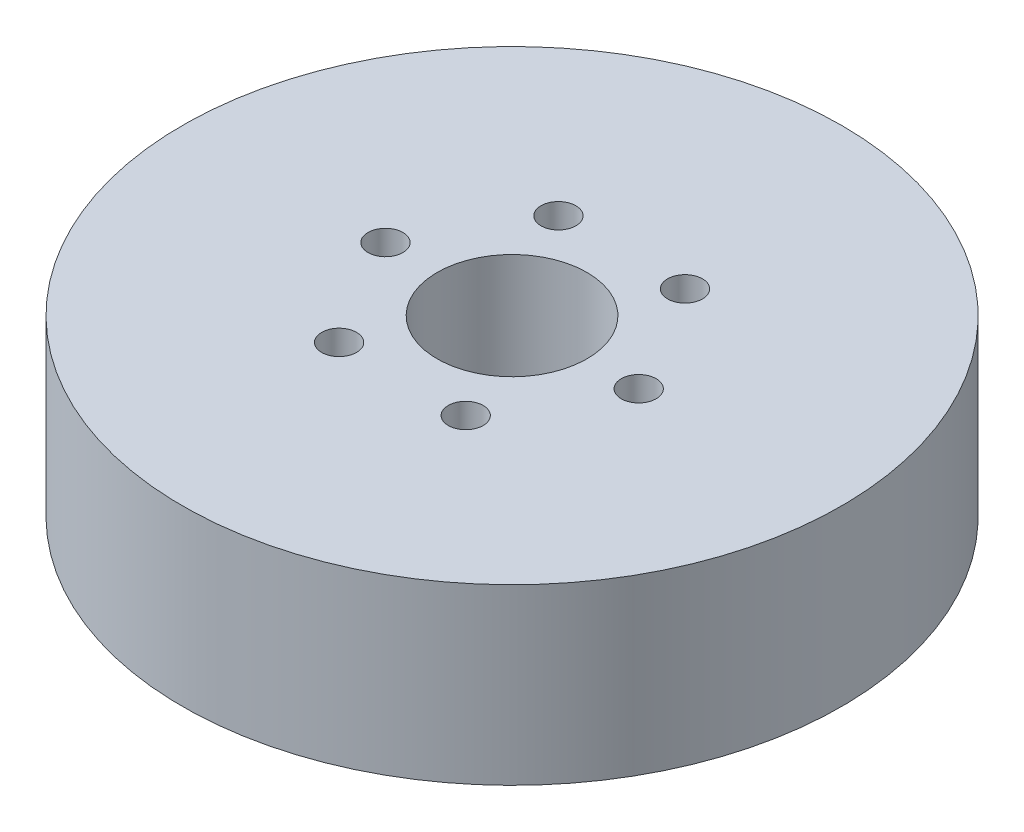
from build123d import *

# Parameters (mm, degrees)
SKETCH1_R           = 55
BOSS_EXTRUDE1_DEPTH = 29
SKETCH2_R           = 12.5
CUT_EXTRUDE1_DEPTH  = 84.012047318
SKETCH3_R           = 2.910677192
CUT_EXTRUDE2_DEPTH  = 25.915961667
CIRPATTERN1_COUNT   = 6


with BuildPart() as part:
    # Sketch1 → Boss-Extrude1 (new body)
    with BuildSketch(Plane(origin=(0, 0, 0), x_dir=(1, 0, 0), z_dir=(0, 1, 0))):
        Circle(SKETCH1_R)
    extrude(amount=BOSS_EXTRUDE1_DEPTH)

    # Sketch2 → Cut-Extrude1 (cut, through all)
    with BuildSketch(Plane(origin=(0, 0, 0), x_dir=(1, 0, 0), z_dir=(0, 1, 0))):
        Circle(SKETCH2_R)
    extrude(amount=CUT_EXTRUDE1_DEPTH, mode=Mode.SUBTRACT)

    # Sketch3 → Cut-Extrude2 (cut)
    with BuildSketch(Plane(origin=(0, 29, 0), x_dir=(1, 0, 0), z_dir=(0, 1, 0))):
        with Locations((-21.130161208, 0)):
            Circle(SKETCH3_R)
    cut_extrude2 = extrude(amount=-CUT_EXTRUDE2_DEPTH, mode=Mode.SUBTRACT)

    # CirPattern1: Cut-Extrude2 ×6 about axis
    cirpattern1_axis = Axis((0, 0, 0), (0, 1, 0))
    for i in range(1, CIRPATTERN1_COUNT):
        add(cut_extrude2.rotate(cirpattern1_axis, i * 360 / CIRPATTERN1_COUNT), mode=Mode.SUBTRACT)


solid = part.part
